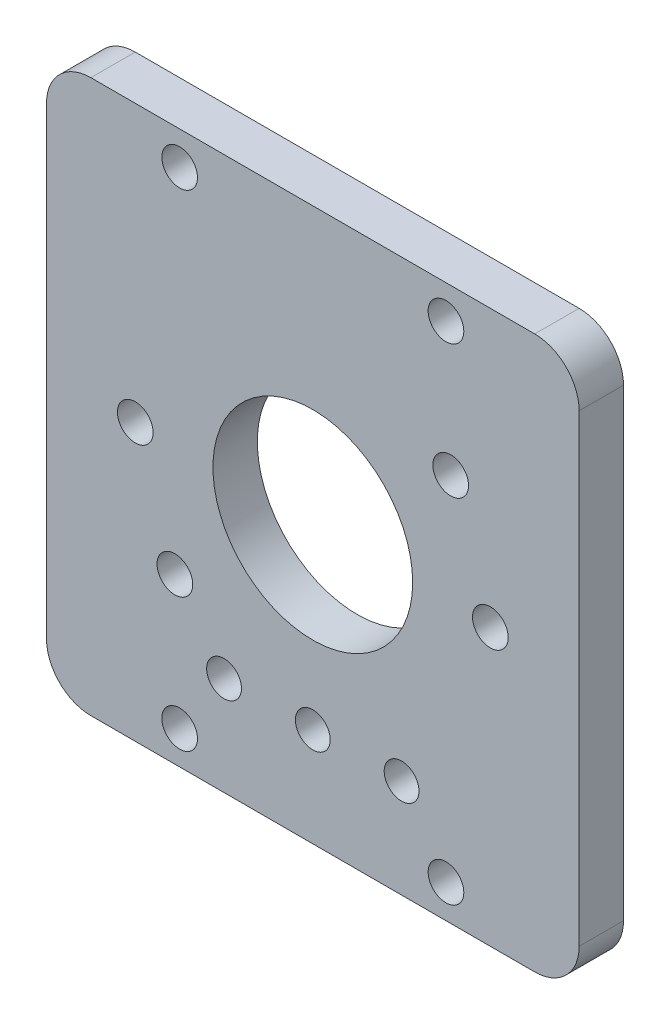
from build123d import *

# Parameters (mm, degrees)
SKETCH5_R           = 2.5527
SKETCH5_R_2         = 2.4892
SKETCH5_R_3         = 14.2875
BOSS_EXTRUDE1_DEPTH = 6.35
FILLET2_R           = 6.35


with BuildPart() as part:
    # Sketch5 → Boss-Extrude1 (new body)
    with BuildSketch(Plane.XY):
        Polygon((-38.1, 39.52494), (-38.1, -39.52494), (-29.558586202, -39.52494), (25.4, -39.52494), (38.1, -39.52494), (38.1, 39.52494), align=None)
        with Locations((-19.05, -34.76244)):
            Circle(SKETCH5_R, mode=Mode.SUBTRACT)
        with Locations((-12.7, -25.4)):
            Circle(SKETCH5_R_2, mode=Mode.SUBTRACT)
        with Locations((-19.731795339, -15.994256867)):
            Circle(SKETCH5_R, mode=Mode.SUBTRACT)
        with Locations((0, -25.4)):
            Circle(SKETCH5_R_2, mode=Mode.SUBTRACT)
        with Locations((12.7, -25.4)):
            Circle(SKETCH5_R_2, mode=Mode.SUBTRACT)
        with Locations((19.05, -34.76244)):
            Circle(SKETCH5_R, mode=Mode.SUBTRACT)
        with Locations((-25.4, 0)):
            Circle(SKETCH5_R, mode=Mode.SUBTRACT)
        with Locations((-19.05, 34.76244)):
            Circle(SKETCH5_R, mode=Mode.SUBTRACT)
        Circle(SKETCH5_R_3, mode=Mode.SUBTRACT)
        with Locations((25.4, 0)):
            Circle(SKETCH5_R, mode=Mode.SUBTRACT)
        with Locations((19.731795339, 15.994256867)):
            Circle(SKETCH5_R, mode=Mode.SUBTRACT)
        with Locations((19.05, 34.76244)):
            Circle(SKETCH5_R, mode=Mode.SUBTRACT)
    extrude(amount=BOSS_EXTRUDE1_DEPTH)

    # Fillet2
    fillet2_edges = [part.edges().sort_by_distance(p)[0] for p in [
        (-38.1, -39.52494, 3.175),
        (38.1, -39.52494, 3.175),
        (38.1, 39.52494, 3.175),
        (-38.1, 39.52494, 3.175),
    ]]
    fillet(fillet2_edges, radius=FILLET2_R)


solid = part.part
